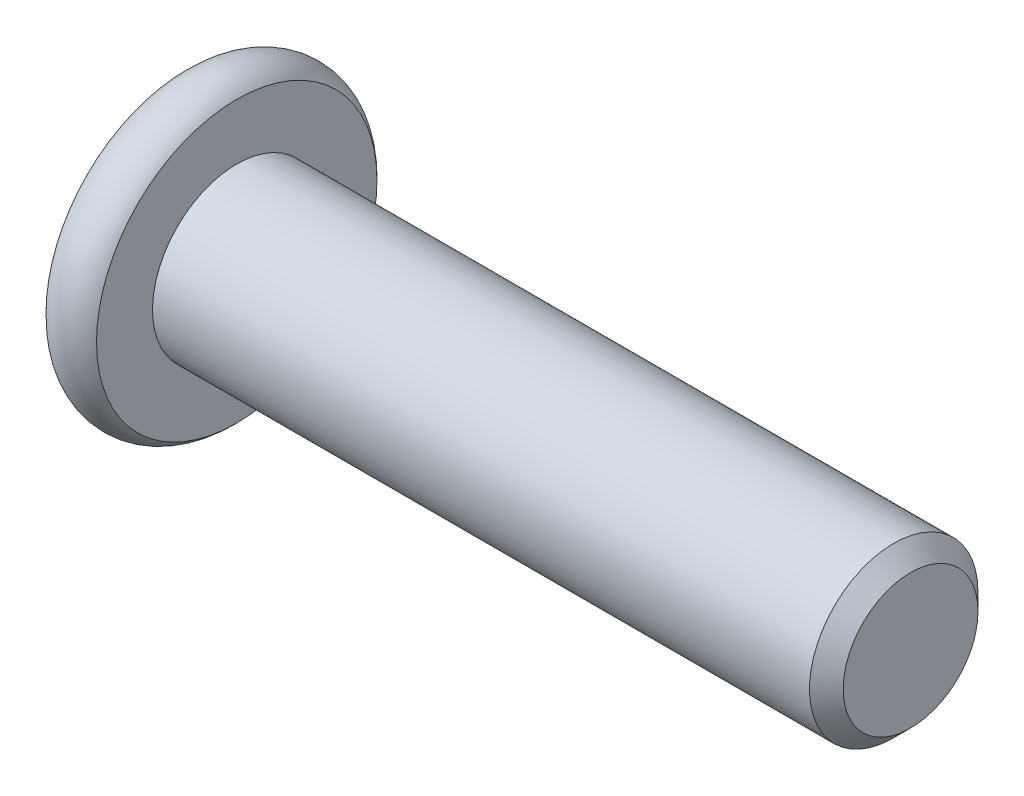
from build123d import *

# Parameters (mm, degrees)
SKETCH2_R           = 2.5
BOSS_EXTRUDE1_DEPTH = 20
CHAMFER1_SIZE       = 0.5
CUT_EXTRUDE1_DEPTH  = 2.3
SKETCH8_R           = 1.782050808
CUT_EXTRUDE2_DEPTH  = 1
CUT_EXTRUDE2_DRAFT  = -45


with BuildPart() as part:
    # Sketch2 → Boss-Extrude1 (new body)
    with BuildSketch(Plane(origin=(0, 0, 0), x_dir=(0, 0, -1), z_dir=(1, 0, 0))):
        Circle(SKETCH2_R)
    extrude(amount=-BOSS_EXTRUDE1_DEPTH)

    # Chamfer1
    chamfer1_edges = [part.edges().sort_by_distance(p)[0] for p in [
        (0, 0, 2.5),
    ]]
    chamfer(chamfer1_edges, length=CHAMFER1_SIZE)

    # Sketch6 → Revolve1 (revolve)
    with BuildSketch(Plane.XY):
        with BuildLine():
            Line((-21.5, 0), (-21.5, 4.161437828))
            ThreePointArc((-21.5, 4.161437828), (-20.75, 4.5), (-20, 4.161437828))
            Line((-20, 4.161437828), (-20, 0))
            Line((-20, 0), (-21.5, 0))
        make_face()
    revolve(axis=Axis((-20, 0, 0), (1, 0, 0)))

    # Sketch7 → Cut-Extrude1 (cut)
    with BuildSketch(Plane.ZY.offset(21.5)):
        Polygon((0, 1.732050808), (-1.5, 0.866025404), (-1.5, -0.866025404), (0, -1.732050808), (1.5, -0.866025404), (1.5, 0.866025404), align=None)
    extrude(amount=-CUT_EXTRUDE1_DEPTH, mode=Mode.SUBTRACT)


with BuildPart() as cut_extrude2_tool:
    # Sketch8 → Cut-Extrude2 (with draft: the straight prism first)
    with BuildSketch(Plane.ZY.offset(21.5)):
        Circle(SKETCH8_R)
    extrude(amount=-CUT_EXTRUDE2_DEPTH)
    # Cut-Extrude2: the draft: its side faces are tilted about the plane it starts from
    cut_extrude2_sides = [cut_extrude2_tool.faces().sort_by_distance(p)[0] for p in [
        (-21, 0, -1.782050808),
    ]]
    draft(cut_extrude2_sides, Plane.ZY.offset(21.5), CUT_EXTRUDE2_DRAFT)


with BuildPart() as part_1:
    add(part.part)

    # Cut-Extrude2: cut by cut_extrude2_tool
    add(cut_extrude2_tool.part, mode=Mode.SUBTRACT)


solid = part_1.part
